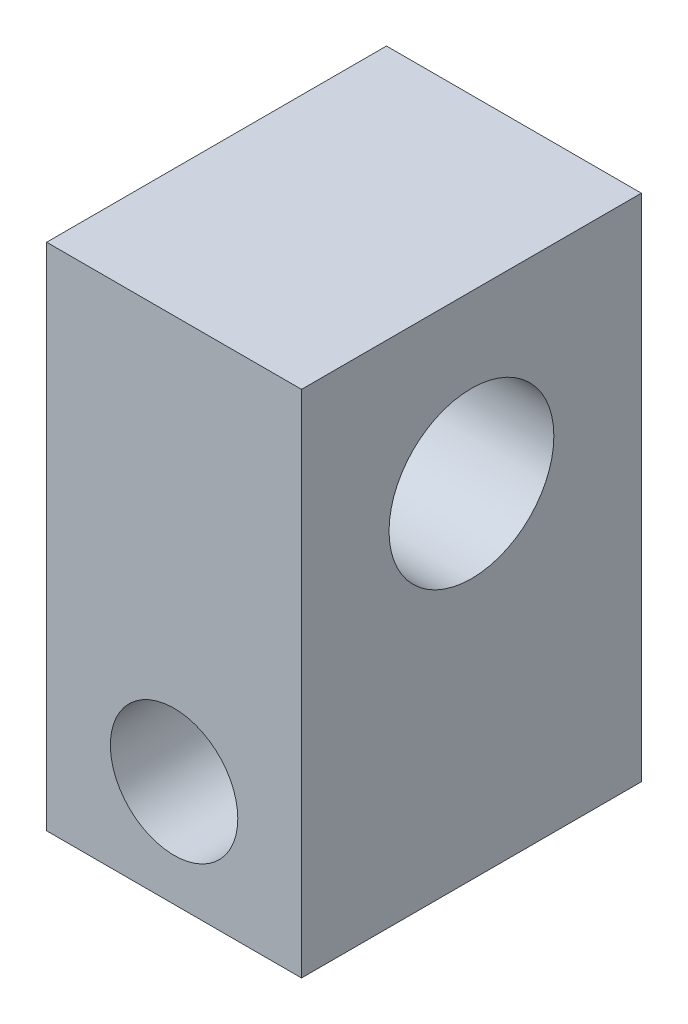
from build123d import *

# Parameters (mm, degrees)
SKETCH1_W           = 19.05
SKETCH1_H           = 25.4
BOSS_EXTRUDE1_DEPTH = 38.1
SKETCH2_R           = 4.7625
CUT_EXTRUDE1_DEPTH  = 47.770670564
SKETCH3_R           = 6.1595
CUT_EXTRUDE2_DEPTH  = 45.45


with BuildPart() as part:
    # Sketch1 → Boss-Extrude1 (new body)
    with BuildSketch(Plane(origin=(0, 0, 0), x_dir=(1, 0, 0), z_dir=(0, 1, 0))):
        Rectangle(SKETCH1_W, SKETCH1_H)
    extrude(amount=BOSS_EXTRUDE1_DEPTH)

    # Sketch2 → Cut-Extrude1 (cut, through all)
    with BuildSketch(Plane.XY.offset(12.7)):
        with Locations((0, 7.9375)):
            Circle(SKETCH2_R)
    extrude(amount=-CUT_EXTRUDE1_DEPTH, mode=Mode.SUBTRACT)

    # Sketch3 → Cut-Extrude2 (cut, through all)
    with BuildSketch(Plane(origin=(9.525, 0, 0), x_dir=(0, 0, -1), z_dir=(1, 0, 0))):
        with Locations((0, 25.654)):
            Circle(SKETCH3_R)
    extrude(amount=-CUT_EXTRUDE2_DEPTH, mode=Mode.SUBTRACT)


solid = part.part
